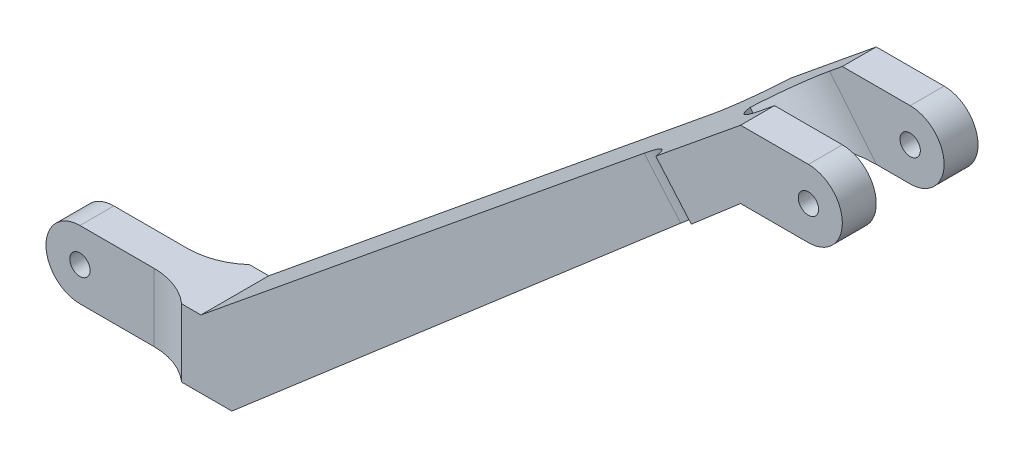
from build123d import *

# Parameters (mm, degrees)
CROQUIS1_R              = 1.5
SALIENTE_EXTRUIR1_DEPTH = 10
CROQUIS2_W              = 45
CROQUIS2_H              = 10.081197804
CORTAR_EXTRUIR1_DEPTH   = 50
CROQUIS3_R              = 1.5
SALIENTE_EXTRUIR2_DEPTH = 10
CROQUIS4_W              = 25
CROQUIS4_H              = 10
CORTAR_EXTRUIR2_DEPTH   = 50
SALIENTE_EXTRUIR3_DEPTH = 10
CROQUIS7_W              = 22
CROQUIS7_H              = 10
CORTAR_EXTRUIR4_DEPTH   = 20
REDONDEO1_R             = 10


with BuildPart() as part:
    # Croquis1 → Saliente-Extruir1 (new body)
    with BuildSketch(Plane.XY):
        with BuildLine():
            Line((0, -5), (-10, -5))
            Line((-10, -5), (-90, -74))
            Line((-90, -74), (-114.8954508, -74))
            ThreePointArc((-114.8954508, -74), (-119.8954508, -69), (-114.8954508, -64))
            Line((-114.8954508, -64), (-94.556304917, -64))
            Line((-94.556304917, -64), (-10, 5))
            Line((-10, 5), (0, 5))
            ThreePointArc((0, 5), (5, 0), (0, -5))
        make_face()
        Circle(CROQUIS1_R, mode=Mode.SUBTRACT)
        with Locations((-114.8954508, -69)):
            Circle(CROQUIS1_R, mode=Mode.SUBTRACT)
    extrude(amount=SALIENTE_EXTRUIR1_DEPTH)

    # Croquis2 → Cortar-Extruir1 (cut)
    with BuildSketch(Plane(origin=(0, -64, 0), x_dir=(1, 0, 0), z_dir=(0, 1, 0))):
        with Locations((-119.8954508, 2.540598902)):
            Rectangle(CROQUIS2_W, CROQUIS2_H)
        with Locations((-119.8954508, -12.540598902)):
            Rectangle(CROQUIS2_W, CROQUIS2_H)
    extrude(amount=-CORTAR_EXTRUIR1_DEPTH, mode=Mode.SUBTRACT)

    # Croquis3 → Saliente-Extruir2 (add, symmetric)
    with BuildSketch(Plane.XY.offset(5)):
        with BuildLine():
            Line((0, 5), (-10, 5))
            Line((-10, 5), (-10, -5))
            Line((-10, -5), (0, -5))
            ThreePointArc((0, -5), (5, 0), (0, 5))
        make_face()
        Circle(CROQUIS3_R, mode=Mode.SUBTRACT)
    extrude(amount=SALIENTE_EXTRUIR2_DEPTH, both=True)

    # Croquis4 → Cortar-Extruir2 (cut)
    with BuildSketch(Plane(origin=(0, 5, 0), x_dir=(1, 0, 0), z_dir=(0, 1, 0))):
        with Locations((5, -5)):
            Rectangle(CROQUIS4_W, CROQUIS4_H)
    extrude(amount=-CORTAR_EXTRUIR2_DEPTH, mode=Mode.SUBTRACT)

    # Croquis5 → Saliente-Extruir3 (add, symmetric)
    with BuildSketch(Plane.XY.offset(5)):
        Polygon((-22.5, -5.200303819), (-17.266882634, -11.267686272), (-10, -5), (-10, 5), align=None)
    extrude(amount=SALIENTE_EXTRUIR3_DEPTH, both=True)

    # Croquis7 → Cortar-Extruir4 (cut)
    with BuildSketch(Plane(origin=(-6.446429036, 7.899800278, 0), x_dir=(0.7747758954984266, 0.6322359620858428, 0), z_dir=(-0.6322359620858428, 0.7747758954984267, 0))):
        with Locations((-6, -5)):
            Rectangle(CROQUIS7_W, CROQUIS7_H)
    extrude(amount=-CORTAR_EXTRUIR4_DEPTH, mode=Mode.SUBTRACT)

    # Redondeo1
    # the kernel refuses this fillet: 10 mm, written as the material it adds along each edge
    with BuildSketch(Plane(origin=(-17.266882634, -11.267686272, 0), x_dir=(0, 0, -1), z_dir=(-0.6531268480840459, 0.757248519517734, 0))) as redondeo1_piece_1_section:
        with BuildLine():
            CenterArc((10, 8.660254038), REDONDEO1_R, 180, 60)
            Line((0, 8.660254038), (-0.2, 8.660254038))
            Line((-0.2, 8.660254038), (-0.2, 0))
            Line((-0.2, 0), (0, -0.2))
            ThreePointArc((0, -0.2), (2.5, -0.2), (4.9, -0.173205081))
            Line((4.9, -0.173205081), (5, 0))
        make_face()
    redondeo1_piece_1 = extrude(amount=29.663040925, mode=Mode.PRIVATE)
    redondeo1_piece_1 = split(redondeo1_piece_1, bisect_by=Plane(origin=(-24.101226761, -6.506943775, -1.290515282), z_dir=(0.6322359620858427, -0.7747758954984267, 0)), keep=Keep.TOP, mode=Mode.PRIVATE)
    add(redondeo1_piece_1)
    with BuildSketch(Plane(origin=(-97.3954508, -64, 2.5), x_dir=(-1, 0, 0), z_dir=(0, -1, 0))) as redondeo1_piece_2:
        with BuildLine():
            CenterArc((6.614378278, 10), REDONDEO1_R, 228.590377891, 41.409622109)
            Line((0, 2.5), (-0.132287566, 2.35))
            ThreePointArc((-0.132287566, 2.35), (-0.2, 1.25), (-0.2, 0))
            Line((-0.2, 0), (0, -0.2))
            Line((0, -0.2), (6.614378278, -0.2))
            Line((6.614378278, -0.2), (6.614378278, 0))
        make_face()
    extrude(amount=10)
    with BuildSketch(Plane(origin=(-97.3954508, -64, 7.5), x_dir=(0, 0, 1), z_dir=(0, -1, 0))) as redondeo1_piece_3:
        with BuildLine():
            CenterArc((10, 6.614378278), REDONDEO1_R, 180, 41.409622109)
            Line((0, 6.614378278), (-0.2, 6.614378278))
            Line((-0.2, 6.614378278), (-0.2, 0))
            Line((-0.2, 0), (0, -0.2))
            ThreePointArc((0, -0.2), (1.25, -0.2), (2.35, -0.132287566))
            Line((2.35, -0.132287566), (2.5, 0))
        make_face()
    extrude(amount=10)
    with BuildSketch(Plane(origin=(-17.266882634, -11.267686272, 10), x_dir=(-0.757248519517734, -0.6531268480840459, 0), z_dir=(-0.6531268480840459, 0.757248519517734, 0))) as redondeo1_piece_4_section:
        with BuildLine():
            CenterArc((8.660254038, 10), REDONDEO1_R, 210, 60)
            Line((0, 5), (-0.173205081, 4.9))
            ThreePointArc((-0.173205081, 4.9), (-0.2, 2.5), (-0.2, 0))
            Line((-0.2, 0), (0, -0.2))
            Line((0, -0.2), (8.660254038, -0.2))
            Line((8.660254038, -0.2), (8.660254038, 0))
        make_face()
    redondeo1_piece_4 = extrude(amount=29.663040925, mode=Mode.PRIVATE)
    redondeo1_piece_4 = split(redondeo1_piece_4, bisect_by=Plane(origin=(-24.101226761, -6.506943775, 11.290515282), z_dir=(0.6322359620858427, -0.7747758954984267, 0)), keep=Keep.TOP, mode=Mode.PRIVATE)
    add(redondeo1_piece_4)
    with BuildSketch(Plane(origin=(-19.617619259, -2.848211077, 0), x_dir=(0, 0, 1), z_dir=(0.6322359620858428, -0.7747758954984266, 0))) as redondeo1_piece_5_section:
        with BuildLine():
            CenterArc((REDONDEO1_R, -REDONDEO1_R), REDONDEO1_R, 90, 90)
            Line((0, -REDONDEO1_R), (-REDONDEO1_R * 0.02, -REDONDEO1_R))
            Line((-REDONDEO1_R * 0.02, -REDONDEO1_R), (-REDONDEO1_R * 0.02, REDONDEO1_R * 0.02))
            Line((-REDONDEO1_R * 0.02, REDONDEO1_R * 0.02), (REDONDEO1_R, REDONDEO1_R * 0.02))
            Line((REDONDEO1_R, REDONDEO1_R * 0.02), (REDONDEO1_R, 0))
        make_face()
    redondeo1_piece_5 = extrude(amount=32.91390687, mode=Mode.PRIVATE)
    redondeo1_piece_5 = split(redondeo1_piece_5, bisect_by=Plane(origin=(-15.697629804, -5, 1.81207327), z_dir=(0, 1, 0)), keep=Keep.TOP, mode=Mode.PRIVATE)
    redondeo1_piece_5 = split(redondeo1_piece_5, bisect_by=Plane(origin=(-12.240787311, -6.932679056, 1.81207327), z_dir=(-0.6531268480840465, 0.7572485195177333, 0)), keep=Keep.TOP, mode=Mode.PRIVATE)
    add(redondeo1_piece_5)
    with BuildSketch(Plane(origin=(-19.617619259, -2.848211077, 0), x_dir=(0, 0, 1), z_dir=(0.6322359620858428, -0.7747758954984266, 0))) as redondeo1_piece_6_section:
        with BuildLine():
            CenterArc((REDONDEO1_R, -REDONDEO1_R), REDONDEO1_R, 90, 90)
            Line((0, -REDONDEO1_R), (-REDONDEO1_R * 0.02, -REDONDEO1_R))
            Line((-REDONDEO1_R * 0.02, -REDONDEO1_R), (-REDONDEO1_R * 0.02, REDONDEO1_R * 0.02))
            Line((-REDONDEO1_R * 0.02, REDONDEO1_R * 0.02), (REDONDEO1_R, REDONDEO1_R * 0.02))
            Line((REDONDEO1_R, REDONDEO1_R * 0.02), (REDONDEO1_R, 0))
        make_face()
    redondeo1_piece_6 = extrude(amount=32.91390687, mode=Mode.PRIVATE)
    redondeo1_piece_6 = split(redondeo1_piece_6, bisect_by=Plane(origin=(-7.753376127, -5, 0.000921207), z_dir=(0, 1, 0)), keep=Keep.TOP, mode=Mode.PRIVATE)
    redondeo1_piece_6 = split(redondeo1_piece_6, bisect_by=Plane(origin=(-8.357285081, -3.583158383, 0.000921207), z_dir=(0.6531268480840465, -0.7572485195177333, 0)), keep=Keep.TOP, mode=Mode.PRIVATE)
    add(redondeo1_piece_6)
    with BuildSketch(Plane(origin=(-19.617619259, -2.848211077, 0), x_dir=(0, 0, 1), z_dir=(0.6322359620858428, -0.7747758954984266, 0))) as redondeo1_piece_7_section:
        with BuildLine():
            CenterArc((REDONDEO1_R, -REDONDEO1_R), REDONDEO1_R, 90, 90)
            Line((0, -REDONDEO1_R), (-REDONDEO1_R * 0.02, -REDONDEO1_R))
            Line((-REDONDEO1_R * 0.02, -REDONDEO1_R), (-REDONDEO1_R * 0.02, REDONDEO1_R * 0.02))
            Line((-REDONDEO1_R * 0.02, REDONDEO1_R * 0.02), (REDONDEO1_R, REDONDEO1_R * 0.02))
            Line((REDONDEO1_R, REDONDEO1_R * 0.02), (REDONDEO1_R, 0))
        make_face()
    redondeo1_piece_7 = extrude(amount=32.91390687, mode=Mode.PRIVATE)
    redondeo1_piece_7 = split(redondeo1_piece_7, bisect_by=Plane(origin=(-14.976833445, -5, 2.906461965), z_dir=(0, -1, 0)), keep=Keep.TOP, mode=Mode.PRIVATE)
    redondeo1_piece_7 = split(redondeo1_piece_7, bisect_by=Plane(origin=(-13.639024157, -8.138658336, 2.906461965), z_dir=(-0.6531268480840465, 0.7572485195177333, 0)), keep=Keep.TOP, mode=Mode.PRIVATE)
    add(redondeo1_piece_7)
    with BuildSketch(Plane(origin=(-19.617619259, -2.848211077, 10), x_dir=(0, 0, -1), z_dir=(0.6322359620858428, -0.7747758954984266, 0))) as redondeo1_piece_8_section:
        with BuildLine():
            CenterArc((REDONDEO1_R, REDONDEO1_R), REDONDEO1_R, 180, 90)
            Line((0, REDONDEO1_R), (-REDONDEO1_R * 0.02, REDONDEO1_R))
            Line((-REDONDEO1_R * 0.02, REDONDEO1_R), (-REDONDEO1_R * 0.02, -REDONDEO1_R * 0.02))
            Line((-REDONDEO1_R * 0.02, -REDONDEO1_R * 0.02), (REDONDEO1_R, -REDONDEO1_R * 0.02))
            Line((REDONDEO1_R, -REDONDEO1_R * 0.02), (REDONDEO1_R, 0))
        make_face()
    redondeo1_piece_8 = extrude(amount=32.91390687, mode=Mode.PRIVATE)
    redondeo1_piece_8 = split(redondeo1_piece_8, bisect_by=Plane(origin=(-15.697629804, -5, 8.18792673), z_dir=(0, 1, 0)), keep=Keep.TOP, mode=Mode.PRIVATE)
    redondeo1_piece_8 = split(redondeo1_piece_8, bisect_by=Plane(origin=(-12.240787311, -6.932679056, 8.18792673), z_dir=(-0.6531268480840465, 0.7572485195177333, 0)), keep=Keep.TOP, mode=Mode.PRIVATE)
    add(redondeo1_piece_8)
    with BuildSketch(Plane(origin=(-19.617619259, -2.848211077, 10), x_dir=(0, 0, -1), z_dir=(0.6322359620858428, -0.7747758954984266, 0))) as redondeo1_piece_9_section:
        with BuildLine():
            CenterArc((REDONDEO1_R, REDONDEO1_R), REDONDEO1_R, 180, 90)
            Line((0, REDONDEO1_R), (-REDONDEO1_R * 0.02, REDONDEO1_R))
            Line((-REDONDEO1_R * 0.02, REDONDEO1_R), (-REDONDEO1_R * 0.02, -REDONDEO1_R * 0.02))
            Line((-REDONDEO1_R * 0.02, -REDONDEO1_R * 0.02), (REDONDEO1_R, -REDONDEO1_R * 0.02))
            Line((REDONDEO1_R, -REDONDEO1_R * 0.02), (REDONDEO1_R, 0))
        make_face()
    redondeo1_piece_9 = extrude(amount=32.91390687, mode=Mode.PRIVATE)
    redondeo1_piece_9 = split(redondeo1_piece_9, bisect_by=Plane(origin=(-7.753376127, -5, 9.999078793), z_dir=(0, 1, 0)), keep=Keep.TOP, mode=Mode.PRIVATE)
    redondeo1_piece_9 = split(redondeo1_piece_9, bisect_by=Plane(origin=(-8.357285081, -3.583158383, 9.999078793), z_dir=(0.6531268480840465, -0.7572485195177333, 0)), keep=Keep.TOP, mode=Mode.PRIVATE)
    add(redondeo1_piece_9)
    with BuildSketch(Plane(origin=(-19.617619259, -2.848211077, 10), x_dir=(0, 0, -1), z_dir=(0.6322359620858428, -0.7747758954984266, 0))) as redondeo1_piece_10_section:
        with BuildLine():
            CenterArc((REDONDEO1_R, REDONDEO1_R), REDONDEO1_R, 180, 90)
            Line((0, REDONDEO1_R), (-REDONDEO1_R * 0.02, REDONDEO1_R))
            Line((-REDONDEO1_R * 0.02, REDONDEO1_R), (-REDONDEO1_R * 0.02, -REDONDEO1_R * 0.02))
            Line((-REDONDEO1_R * 0.02, -REDONDEO1_R * 0.02), (REDONDEO1_R, -REDONDEO1_R * 0.02))
            Line((REDONDEO1_R, -REDONDEO1_R * 0.02), (REDONDEO1_R, 0))
        make_face()
    redondeo1_piece_10 = extrude(amount=32.91390687, mode=Mode.PRIVATE)
    redondeo1_piece_10 = split(redondeo1_piece_10, bisect_by=Plane(origin=(-14.976833445, -5, 7.093538035), z_dir=(0, -1, 0)), keep=Keep.TOP, mode=Mode.PRIVATE)
    redondeo1_piece_10 = split(redondeo1_piece_10, bisect_by=Plane(origin=(-13.639024157, -8.138658336, 7.093538035), z_dir=(-0.6531268480840465, 0.7572485195177333, 0)), keep=Keep.TOP, mode=Mode.PRIVATE)
    add(redondeo1_piece_10)


solid = part.part
